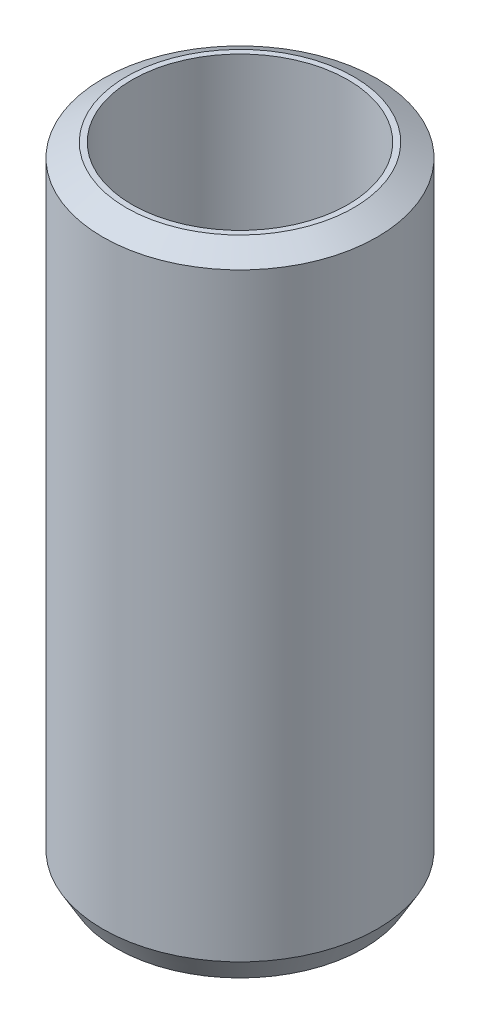
from build123d import *
from OCP.BRepFilletAPI import BRepFilletAPI_MakeChamfer

# Parameters (mm, degrees)
SKETCH1_R           = 40
BOSS_EXTRUDE1_DEPTH = 185.539007094
SKETCH2_R           = 31.499385174
CUT_EXTRUDE1_DEPTH  = 194.970933785
CHAMFER1_SIZE       = 3.961443543
CHAMFER1_SIZE2      = 6.861421487


with BuildPart() as part:
    # Sketch1 → Boss-Extrude1 (new body)
    with BuildSketch(Plane(origin=(0, 0, 0), x_dir=(1, 0, 0), z_dir=(0, 1, 0))):
        Circle(SKETCH1_R)
    extrude(amount=BOSS_EXTRUDE1_DEPTH)

    # Sketch2 → Cut-Extrude1 (cut, through all)
    with BuildSketch(Plane(origin=(0, 0, 0), x_dir=(1, 0, 0), z_dir=(0, 1, 0))):
        Circle(SKETCH2_R)
    extrude(amount=CUT_EXTRUDE1_DEPTH, mode=Mode.SUBTRACT)

    # Chamfer1: one chamfer whose edges measure the first distance from different faces: ONE call of the kernel's chamfer builder (chamfer() names one face for all edges)
    chamfer1_edges_1 = [part.edges().sort_by_distance(p)[0] for p in [
        (-40, 185.539007094, 0),
    ]]
    chamfer1_side_1 = [part.faces().sort_by_distance(p)[0] for p in [
        (-40, 92.769503547, 0),
    ]]
    chamfer1_edges_2 = [part.edges().sort_by_distance(p)[0] for p in [
        (-40, 0, 0),
    ]]
    chamfer1_side_2 = [part.faces().sort_by_distance(p)[0] for p in [
        (-38.86862915, 0, 0),
    ]]
    chamfer1 = BRepFilletAPI_MakeChamfer(part.part.solid().wrapped)
    for e in chamfer1_edges_1:
        chamfer1.Add(CHAMFER1_SIZE, CHAMFER1_SIZE2, e.wrapped, chamfer1_side_1[0].wrapped)  # the first distance lies on this face
    for e in chamfer1_edges_2:
        chamfer1.Add(CHAMFER1_SIZE, CHAMFER1_SIZE2, e.wrapped, chamfer1_side_2[0].wrapped)  # the first distance lies on this face
    add(Compound.cast(chamfer1.Shape()), mode=Mode.REPLACE)


solid = part.part
